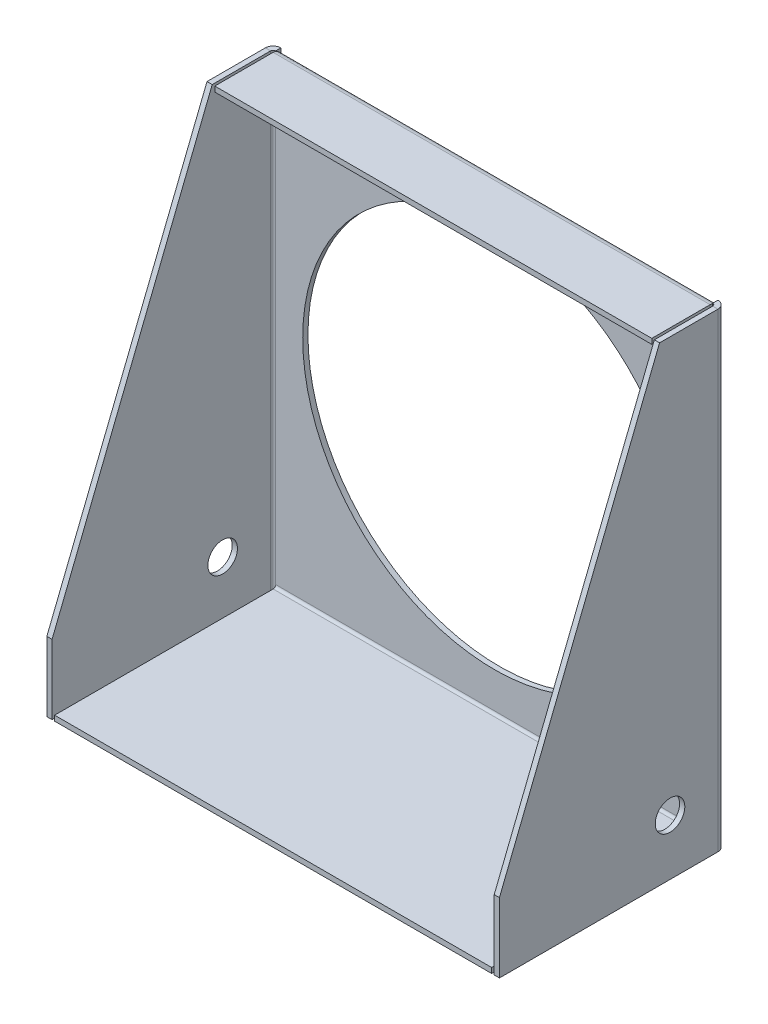
from build123d import *

# Parameters (mm, degrees)
SKETCH1_W                    = 130
SKETCH1_H                    = 135
BASE_FLANGE2_DEPTH           = 1.5
EDGE_FLANGE5_STRIP_W         = 7.4732
EDGE_FLANGE5_STRIP_H         = 1.5
EDGE_FLANGE5_STRIP_CUT_DEPTH = 135
EDGE_FLANGE5_DEPTH           = 135
EDGE_FLANGE6_STRIP_W         = 7.4732
EDGE_FLANGE6_STRIP_H         = 1.5
EDGE_FLANGE6_STRIP_CUT_DEPTH = 135
EDGE_FLANGE6_DEPTH           = 135
EDGE_FLANGE7_STRIP_W         = 7.4732
EDGE_FLANGE7_STRIP_H         = 1.5
EDGE_FLANGE7_STRIP_CUT_DEPTH = 125.5268
EDGE_FLANGE7_DEPTH           = 125.5268
CUT_EXTRUDE1_START           = -130
CUT_EXTRUDE1_OUTLINE_R       = 4.25
CUT_EXTRUDE1_DEPTH           = 130
CUT_EXTRUDE1_START_2         = -127.7634
CUT_EXTRUDE1_2_DEPTH         = 125.5268
SKETCH39_R                   = 55
CUT_EXTRUDE2_DEPTH           = 10
EDGE_FLANGE8_STRIP_W         = 7.4732
EDGE_FLANGE8_STRIP_H         = 1.5
EDGE_FLANGE8_STRIP_CUT_DEPTH = 125.5268
EDGE_FLANGE8_DEPTH           = 125.5268


# Read off the part's stored shape, not the designer's step: Cut-Extrude1
# Sheet-metal steps are written as plain solids
with BuildPart() as part:
    # Sketch1 → Base-Flange2 (new body)
    with BuildSketch(Plane.XY):
        with Locations((1.766304348, -20.692934783)):
            Rectangle(SKETCH1_W, SKETCH1_H)
    extrude(amount=-BASE_FLANGE2_DEPTH)

    # Edge-Flange5 strip (across the edge) → Edge-Flange5 strip cut (cut)
    with BuildSketch(Plane(origin=(66.766304348, -88.192934783, 0), x_dir=(-1, 0, 0), z_dir=(0, 1, 0))):
        with Locations((-1.5, -0.75)):
            Rectangle(EDGE_FLANGE5_STRIP_W, EDGE_FLANGE5_STRIP_H)
    extrude(amount=EDGE_FLANGE5_STRIP_CUT_DEPTH, mode=Mode.SUBTRACT)

    # Edge-Flange5 section (across the edge) → Edge-Flange5 (add)
    with BuildSketch(Plane(origin=(66.766304348, -88.192934783, 0), x_dir=(-1, 0, 0), z_dir=(0, 1, 0))):
        with BuildLine():
            Line((0, 0.7366), (0, 63.5))
            Line((0, 63.5), (1.5, 63.5))
            Line((1.5, 63.5), (1.5, 0.7366))
            ThreePointArc((1.5, 0.7366), (1.715745145, 0.215745145), (2.2366, 0))
            Line((2.2366, 0), (2.2366, -1.5))
            ThreePointArc((2.2366, -1.5), (0.655084973, -0.844915027), (0, 0.7366))
        make_face()
    extrude(amount=EDGE_FLANGE5_DEPTH)

    # Edge-Flange6 strip (across the edge) → Edge-Flange6 strip cut (cut)
    with BuildSketch(Plane(origin=(-63.233695652, 46.807065217, 0), x_dir=(1, 0, 0), z_dir=(0, -1, 0))):
        with Locations((-1.5, -0.75)):
            Rectangle(EDGE_FLANGE6_STRIP_W, EDGE_FLANGE6_STRIP_H)
    extrude(amount=EDGE_FLANGE6_STRIP_CUT_DEPTH, mode=Mode.SUBTRACT)

    # Edge-Flange6 section (across the edge) → Edge-Flange6 (add)
    with BuildSketch(Plane(origin=(-63.233695652, 46.807065217, 0), x_dir=(1, 0, 0), z_dir=(0, -1, 0))):
        with BuildLine():
            Line((0, 0.7366), (0, 63.5))
            Line((0, 63.5), (1.5, 63.5))
            Line((1.5, 63.5), (1.5, 0.7366))
            ThreePointArc((1.5, 0.7366), (1.715745145, 0.215745145), (2.2366, 0))
            Line((2.2366, 0), (2.2366, -1.5))
            ThreePointArc((2.2366, -1.5), (0.655084973, -0.844915027), (0, 0.7366))
        make_face()
    extrude(amount=EDGE_FLANGE6_DEPTH)

    # Edge-Flange7 strip (across the edge) → Edge-Flange7 strip cut (cut)
    with BuildSketch(Plane(origin=(64.529704348, 46.807065217, 0), x_dir=(0, -1, 0), z_dir=(-1, 0, 0))):
        with Locations((-1.5, -0.75)):
            Rectangle(EDGE_FLANGE7_STRIP_W, EDGE_FLANGE7_STRIP_H)
    extrude(amount=EDGE_FLANGE7_STRIP_CUT_DEPTH, mode=Mode.SUBTRACT)

    # Edge-Flange7 section (across the edge) → Edge-Flange7 (add)
    with BuildSketch(Plane(origin=(64.529704348, 46.807065217, 0), x_dir=(0, -1, 0), z_dir=(-1, 0, 0))):
        with BuildLine():
            Line((0, 0.7366), (0, 22.5))
            Line((0, 22.5), (1.5, 22.5))
            Line((1.5, 22.5), (1.5, 0.7366))
            ThreePointArc((1.5, 0.7366), (1.715745145, 0.215745145), (2.2366, 0))
            Line((2.2366, 0), (2.2366, -1.5))
            ThreePointArc((2.2366, -1.5), (0.655084973, -0.844915027), (0, 0.7366))
        make_face()
    extrude(amount=EDGE_FLANGE7_DEPTH)

    # Cut-Extrude1 outline → Cut-Extrude1 (cut)
    with BuildSketch(Plane(origin=(66.766304348, 0, 0), x_dir=(0, 0, -1), z_dir=(1, 0, 0)).offset(CUT_EXTRUDE1_START)):
        with Locations((-14.5, -72.192934783)):
            Circle(CUT_EXTRUDE1_OUTLINE_R)
        Polygon((-17.5, 46.807065217), (-63.5, 46.807065217), (-63.5, -68.192934783), align=None)
    extrude(amount=CUT_EXTRUDE1_DEPTH, mode=Mode.SUBTRACT)

    # Cut-Extrude1 2 outline → Cut-Extrude1 2 (cut)
    with BuildSketch(Plane(origin=(66.766304348, 0, 0), x_dir=(0, 0, -1), z_dir=(1, 0, 0)).offset(CUT_EXTRUDE1_START_2)):
        Polygon((-17.5, 45.307065217), (-17.5, 46.807065217), (-18.1, 45.307065217), align=None)
    extrude(amount=CUT_EXTRUDE1_2_DEPTH, mode=Mode.SUBTRACT)

    # Sketch39 → Cut-Extrude2 (cut)
    with BuildSketch(Plane(origin=(0, 0, -1.5), x_dir=(-1, 0, 0), z_dir=(0, 0, -1))):
        with Locations((-1.766304348, -20.692934783)):
            Circle(SKETCH39_R)
    extrude(amount=-CUT_EXTRUDE2_DEPTH, mode=Mode.SUBTRACT)

    # Edge-Flange8 strip (across the edge) → Edge-Flange8 strip cut (cut)
    with BuildSketch(Plane(origin=(-60.997095652, -88.192934783, 0), x_dir=(0, 1, 0), z_dir=(1, 0, 0))):
        with Locations((-1.5, -0.75)):
            Rectangle(EDGE_FLANGE8_STRIP_W, EDGE_FLANGE8_STRIP_H)
    extrude(amount=EDGE_FLANGE8_STRIP_CUT_DEPTH, mode=Mode.SUBTRACT)

    # Edge-Flange8 section (across the edge) → Edge-Flange8 (add)
    with BuildSketch(Plane(origin=(-60.997095652, -88.192934783, 0), x_dir=(0, 1, 0), z_dir=(1, 0, 0))):
        with BuildLine():
            Line((0, 0.7366), (0, 63.5))
            Line((0, 63.5), (1.5, 63.5))
            Line((1.5, 63.5), (1.5, 0.7366))
            ThreePointArc((1.5, 0.7366), (1.715745145, 0.215745145), (2.2366, 0))
            Line((2.2366, 0), (2.2366, -1.5))
            ThreePointArc((2.2366, -1.5), (0.655084973, -0.844915027), (0, 0.7366))
        make_face()
    extrude(amount=EDGE_FLANGE8_DEPTH)


solid = part.part
